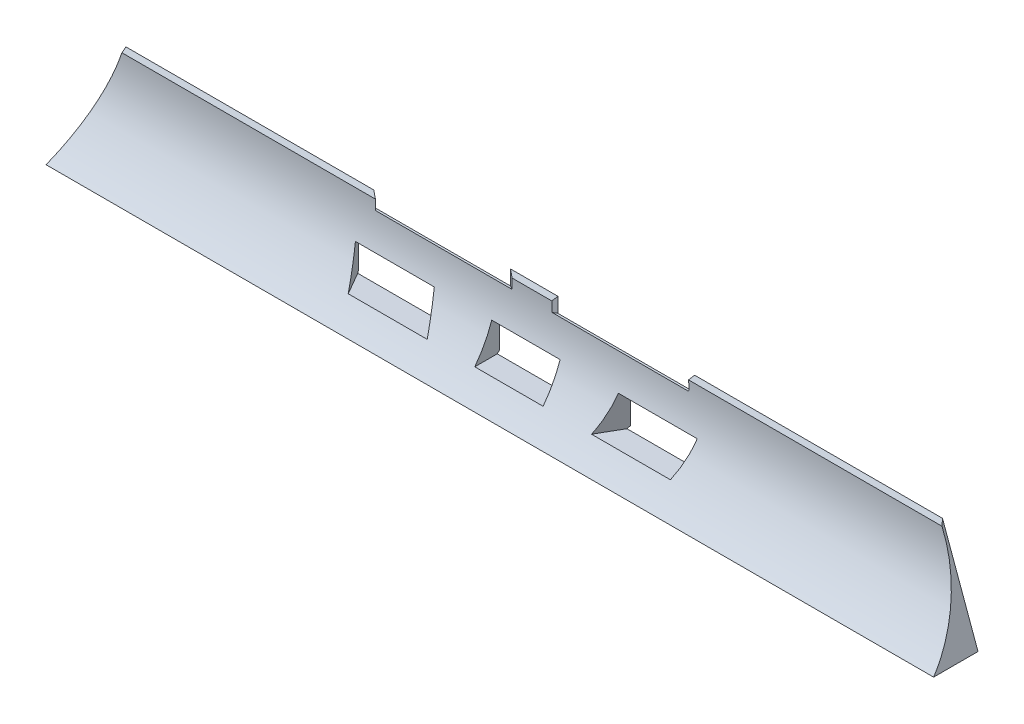
from build123d import *

# Parameters (mm, degrees)
BOSS_EXTRUDE1_DEPTH = 200
CUT_EXTRUDE1_DEPTH  = 202.45470955
CUT_EXTRUDE2_DEPTH  = 202.45470955
BOSS_EXTRUDE2_REACH = 203.455
SKETCH5_W           = 3
SKETCH5_H           = 5
CUT_EXTRUDE3_DEPTH  = 202.45470955
BOSS_EXTRUDE3_REACH = 203.455
SKETCH7_W           = 8
SKETCH7_H           = 11
CUT_EXTRUDE4_DEPTH  = 1.8
SKETCH9_W           = 15.4
SKETCH9_H           = 7.2
CUT_EXTRUDE6_DEPTH  = 202.45470955
CUT_EXTRUDE8_START  = -6.8
SKETCH10_W          = 15.4
SKETCH10_H          = 7.2
CUT_EXTRUDE8_DEPTH  = 22.6
SKETCH11_W          = 15.4
SKETCH11_H          = 8.8
CUT_EXTRUDE9_DEPTH  = 97.8


with BuildPart() as part:
    # Sketch1 → Boss-Extrude1 (new body)
    with BuildSketch(Plane(origin=(0, 0, 0), x_dir=(0, 0, -1), z_dir=(1, 0, 0))):
        Polygon((0, 0), (-10, 0), (0, 22), align=None)
    extrude(amount=BOSS_EXTRUDE1_DEPTH)

    # Sketch2 → Cut-Extrude1 (cut, through all)
    with BuildSketch(Plane(origin=(200, 0, 0), x_dir=(0, 0, -1), z_dir=(1, 0, 0))):
        with BuildLine():
            Line((-10, 0), (-0.5, 20.9))
            ThreePointArc((-0.5, 20.9), (-2.709071222, 9.295032374), (-10, 0))
        make_face()
    extrude(amount=-CUT_EXTRUDE1_DEPTH, mode=Mode.SUBTRACT)

    # Sketch4 → Cut-Extrude2 (cut, through all)
    with BuildSketch(Plane(origin=(200, 0, 0), x_dir=(0, 0, -1), z_dir=(1, 0, 0))):
        Polygon((-5, 0), (0, 5), (0, 0), align=None)
    extrude(amount=-CUT_EXTRUDE2_DEPTH, mode=Mode.SUBTRACT)

    # Boss-Extrude2: up to this face of the body (flat: up to its plane)
    boss_extrude2_end = Plane(part.part.faces().sort_by_distance((100, 2.5, 2.5))[0])
    # Sketch5 → Boss-Extrude2 (add, up to the picked face)
    with BuildSketch(Plane(origin=(0, 0, 0), x_dir=(-1, 0, 0), z_dir=(0, 0, -1)), mode=Mode.PRIVATE) as boss_extrude2_sk1:
        with Locations((-198.5, 2.5)):
            Rectangle(SKETCH5_W, SKETCH5_H)
    boss_extrude2_tool1 = split(extrude(boss_extrude2_sk1.sketch, amount=-BOSS_EXTRUDE2_REACH, mode=Mode.PRIVATE), bisect_by=boss_extrude2_end, keep=Keep.BOTH, mode=Mode.PRIVATE)
    boss_extrude2 = boss_extrude2_tool1.solids().sort_by(Axis((198.5, 2.5, 0), (0, 0, 1)))[0]
    add(boss_extrude2)

    # Sketch6 → Cut-Extrude3 (cut, through all)
    with BuildSketch(Plane(origin=(0, 0, 0), x_dir=(-1, 0, 0), z_dir=(0, 0, -1))):
        Polygon((-200, 22), (-191.992654846, 22), (-200, 0), align=None)
    cut_extrude3 = extrude(amount=-CUT_EXTRUDE3_DEPTH, mode=Mode.SUBTRACT)

    # Mirror2: Boss-Extrude2, Cut-Extrude3 across plane
    add(boss_extrude2.mirror(Plane(origin=(100, 0, 0), x_dir=(0, 0, 1), z_dir=(1, 0, 0))))
    add(cut_extrude3.mirror(Plane(origin=(100, 0, 0), x_dir=(0, 0, 1), z_dir=(1, 0, 0))), mode=Mode.SUBTRACT)

    # Sketch7 → Boss-Extrude3 (add, up to next)
    with BuildSketch(Plane(origin=(0, 0, 0), x_dir=(-1, 0, 0), z_dir=(0, 0, -1)), mode=Mode.PRIVATE) as boss_extrude3_sk1:
        with Locations((-163.831600122, 7.965)):
            Rectangle(SKETCH7_W, SKETCH7_H)
    boss_extrude3_tool1 = extrude(boss_extrude3_sk1.sketch, amount=-BOSS_EXTRUDE3_REACH, mode=Mode.PRIVATE) - part.part
    boss_extrude3 = boss_extrude3_tool1.solids().sort_by_distance((163.8316, 7.965, 0))[0]
    add(boss_extrude3)

    # Sketch8 → Cut-Extrude4 (cut)
    with BuildSketch(Plane(origin=(0, 0, 0), x_dir=(-1, 0, 0), z_dir=(0, 0, -1))):
        Polygon((-162.099549314, 8.5), (-165.56365093, 8.5), (-167.295701737, 5.5), (-165.56365093, 2.5), (-162.099549314, 2.5), (-160.367498507, 5.5), align=None)
    cut_extrude4 = extrude(amount=-CUT_EXTRUDE4_DEPTH, mode=Mode.SUBTRACT)

    # Mirror3: Boss-Extrude3, Cut-Extrude4 across plane
    add(boss_extrude3.mirror(Plane(origin=(100, 0, 0), x_dir=(0, 0, 1), z_dir=(1, 0, 0))))
    add(cut_extrude4.mirror(Plane(origin=(100, 0, 0), x_dir=(0, 0, 1), z_dir=(1, 0, 0))), mode=Mode.SUBTRACT)

    # Sketch9 → Cut-Extrude6 (cut, through all)
    with BuildSketch(Plane.XY):
        with Locations((99.915800061, 8.065)):
            Rectangle(SKETCH9_W, SKETCH9_H)
    extrude(amount=CUT_EXTRUDE6_DEPTH, mode=Mode.SUBTRACT)

    # Sketch10 → Cut-Extrude8 (cut)
    with BuildSketch(Plane(origin=(32.136000823, 0, -55.661186177), x_dir=(0.866025403784433, 0, 0.5000000000000099), z_dir=(-0.5000000000000098, 0, 0.8660254037844329)).offset(CUT_EXTRUDE8_START)):
        with Locations((113.139032853, 8.065)):
            Rectangle(SKETCH10_W, SKETCH10_H)
    cut_extrude8 = extrude(amount=CUT_EXTRUDE8_DEPTH, mode=Mode.SUBTRACT)

    # Sketch11 → Cut-Extrude9 (cut)
    with BuildSketch(Plane(origin=(115.669713788, 0, -66.781940393), x_dir=(0.4999999999999981, -1.9080601945838373e-15, 0.8660254037844397), z_dir=(-0.8660254037844397, 3.3048572009189827e-15, 0.4999999999999981))):
        with Locations((60.371690641, 23.065)):
            Rectangle(SKETCH11_W, SKETCH11_H)
    cut_extrude9 = extrude(amount=CUT_EXTRUDE9_DEPTH, mode=Mode.SUBTRACT)

    # Mirror4: Cut-Extrude8, Cut-Extrude9 across plane
    add(cut_extrude8.mirror(Plane(origin=(100, 0, 0), x_dir=(0, 0, 1), z_dir=(1, 0, 0))), mode=Mode.SUBTRACT)
    add(cut_extrude9.mirror(Plane(origin=(100, 0, 0), x_dir=(0, 0, 1), z_dir=(1, 0, 0))), mode=Mode.SUBTRACT)


solid = part.part
